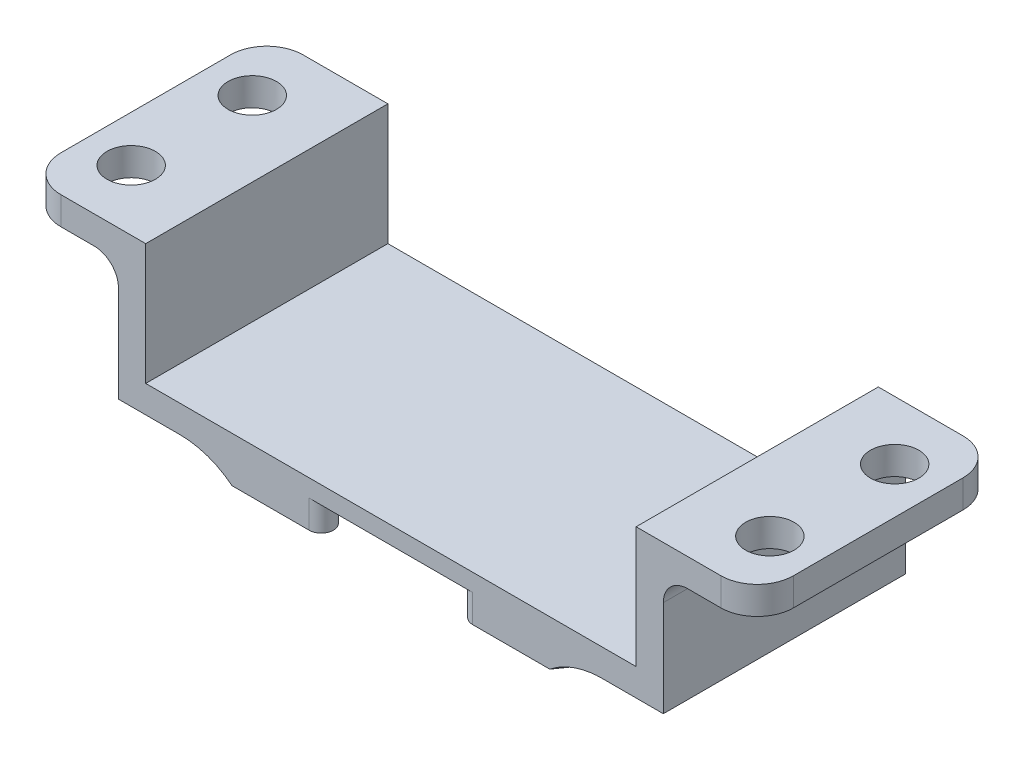
from build123d import *

# Parameters (mm, degrees)
SKETCH1_W           = 45
SKETCH1_H           = 20
BOSS_EXTRUDE1_DEPTH = 2.25
SKETCH2_W           = 2.25
SKETCH2_H           = 20
BOSS_EXTRUDE2_DEPTH = 10
SKETCH3_W           = 10
SKETCH3_H           = 20
BOSS_EXTRUDE3_DEPTH = 2.3
FILLET1_R           = 2
SKETCH4_R           = 2
CUT_EXTRUDE1_DEPTH  = 35.133927404
BOSS_EXTRUDE5_DEPTH = 1.5
SKETCH6_R           = 10.25
CUT_EXTRUDE2_DEPTH  = 2.3
FILLET2_R           = 5
FILLET3_R           = 1
FILLET4_R           = 3


with BuildPart() as part:
    # Sketch1 → Boss-Extrude1 (new body)
    with BuildSketch(Plane(origin=(0, 0, 0), x_dir=(1, 0, 0), z_dir=(0, 1, 0))):
        Rectangle(SKETCH1_W, SKETCH1_H)
    extrude(amount=BOSS_EXTRUDE1_DEPTH)

    # Sketch2 → Boss-Extrude2 (add)
    with BuildSketch(Plane(origin=(0, 2.25, 0), x_dir=(1, 0, 0), z_dir=(0, 1, 0))):
        with Locations((-21.375, 0)):
            Rectangle(SKETCH2_W, SKETCH2_H)
        with Locations((21.375, 0)):
            Rectangle(SKETCH2_W, SKETCH2_H)
    extrude(amount=BOSS_EXTRUDE2_DEPTH)

    # Sketch3 → Boss-Extrude3 (add)
    with BuildSketch(Plane(origin=(0, 12.25, 0), x_dir=(1, 0, 0), z_dir=(0, 1, 0))):
        with Locations((-25.25, 0)):
            Rectangle(SKETCH3_W, SKETCH3_H)
        with Locations((25.25, 0)):
            Rectangle(SKETCH3_W, SKETCH3_H)
    extrude(amount=-BOSS_EXTRUDE3_DEPTH)

    # Fillet1
    fillet1_edges = [part.edges().sort_by_distance(p)[0] for p in [
        (-22.5, 9.95, 0),
        (22.5, 9.95, 0),
    ]]
    fillet(fillet1_edges, radius=FILLET1_R)

    # Sketch4 → Cut-Extrude1 (cut, through all)
    with BuildSketch(Plane(origin=(0, 12.25, 0), x_dir=(1, 0, 0), z_dir=(0, 1, 0))):
        with Locations(Location((26.45, 5.15278214, 0), (0, 0, 270))):
            Circle(SKETCH4_R)
        with Locations(Location((26.45, -5.15278214, 0), (0, 0, 270))):
            Circle(SKETCH4_R)
        with Locations(Location((-26.45, 5, 0), (0, 0, 270))):
            Circle(SKETCH4_R)
        with Locations(Location((-26.45, -5, 0), (0, 0, 270))):
            Circle(SKETCH4_R)
    extrude(amount=-CUT_EXTRUDE1_DEPTH, mode=Mode.SUBTRACT)

    # Sketch5 → Boss-Extrude5 (add)
    with BuildSketch(Plane.XZ):
        with BuildLine():
            Line((13.124404748, 10), (-13.124404748, 10))
            ThreePointArc((-13.124404748, 10), (-16.5, 0), (-13.124404748, -10))
            Line((-13.124404748, -10), (13.124404748, -10))
            ThreePointArc((13.124404748, -10), (16.5, 0), (13.124404748, 10))
        make_face()
    extrude(amount=BOSS_EXTRUDE5_DEPTH)

    # Sketch6 → Cut-Extrude2 (cut)
    with BuildSketch(Plane.XZ.offset(1.5)):
        Circle(SKETCH6_R)
    extrude(amount=-CUT_EXTRUDE2_DEPTH, mode=Mode.SUBTRACT)

    # Fillet2
    # the kernel refuses this fillet: 5 mm, written as the material it adds along each edge
    with BuildSketch(Plane(origin=(0, 0, 0), x_dir=(0.3695559443518841, 0, -0.9292084825238021), z_dir=(-0.9292084825238021, 0, -0.3695559443518841))) as fillet2_piece_1_section:
        with BuildLine():
            CenterArc((20.070714214, 5), FILLET2_R, 224.427004001, 45.572995999)
            Line((16.5, 1.5), (16.428585716, 1.43))
            ThreePointArc((16.428585716, 1.43), (16.4, 0.75), (16.4, 0))
            Line((16.4, 0), (16.5, -0.1))
            Line((16.5, -0.1), (20.070714214, -0.1))
            Line((20.070714214, -0.1), (20.070714214, 0))
        make_face()
    fillet2_piece_1 = revolve(axis=Axis((0, 0, 0), (0, -1, 0)), revolution_arc=136.623532333, mode=Mode.PRIVATE)
    fillet2_piece_1 = split(fillet2_piece_1, bisect_by=Plane(origin=(18.120334402, -0.357167387, 10), z_dir=(0, 0, -1)), keep=Keep.TOP, mode=Mode.PRIVATE)
    fillet2_piece_1 = split(fillet2_piece_1, bisect_by=Plane(origin=(18.120334402, -0.357167387, -10), z_dir=(0, 0, 1)), keep=Keep.TOP, mode=Mode.PRIVATE)
    add(fillet2_piece_1)
    with BuildSketch(Plane(origin=(0, 0, 0), x_dir=(-0.3695559443518876, 0, 0.9292084825238008), z_dir=(0.9292084825238008, 0, 0.3695559443518876))) as fillet2_piece_2_section:
        with BuildLine():
            CenterArc((20.070714214, 5), FILLET2_R, 224.427004001, 45.572995999)
            Line((20.070714214, 0), (20.070714214, -0.1))
            Line((20.070714214, -0.1), (16.5, -0.1))
            Line((16.5, -0.1), (16.4, 0))
            ThreePointArc((16.4, 0), (16.4, 0.75), (16.428585716, 1.43))
            Line((16.428585716, 1.43), (16.5, 1.5))
        make_face()
    fillet2_piece_2 = revolve(axis=Axis((0, 0, 0), (0, -1, 0)), revolution_arc=136.623532333, mode=Mode.PRIVATE)
    fillet2_piece_2 = split(fillet2_piece_2, bisect_by=Plane(origin=(-18.120334402, -0.357167387, 10), z_dir=(0, 0, -1)), keep=Keep.TOP, mode=Mode.PRIVATE)
    fillet2_piece_2 = split(fillet2_piece_2, bisect_by=Plane(origin=(-18.120334402, -0.357167387, -10), z_dir=(0, 0, 1)), keep=Keep.TOP, mode=Mode.PRIVATE)
    add(fillet2_piece_2)

    # Fillet3
    fillet3_edges = [part.edges().sort_by_distance(p)[0] for p in [
        (-2.25, -0.35, -10),
        (-2.25, -0.35, 10),
        (2.25, -0.35, -10),
        (2.25, -0.35, 10),
    ]]
    fillet(fillet3_edges, radius=FILLET3_R)

    # Fillet4
    fillet4_edges = [part.edges().sort_by_distance(p)[0] for p in [
        (-30.25, 11.1, -10),
        (-30.25, 11.1, 10),
        (30.25, 11.1, 10),
        (30.25, 11.1, -10),
    ]]
    fillet(fillet4_edges, radius=FILLET4_R)


solid = part.part
